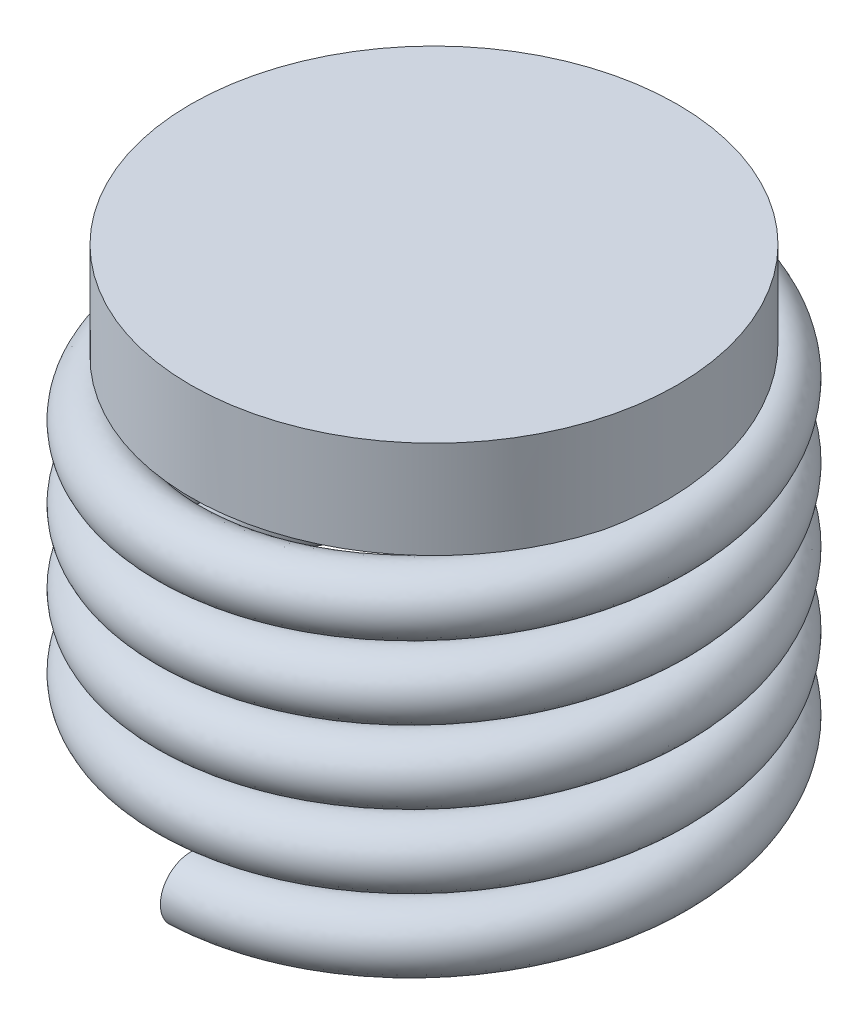
from build123d import *

# Parameters (mm, degrees)
SKETCH_1_R      = 10
EXTRUDE_1_DEPTH = 4
SWEEP_1_PITCH   = 3


with BuildPart() as part:
    # 草图1 → 凸台-拉伸1 (new body)
    with BuildSketch(Plane(origin=(0, 0, 0), x_dir=(1, 0, 0), z_dir=(0, 1, 0))):
        with Locations(Location((0, 0, 0), (0, 0, 270))):
            Circle(SKETCH_1_R)
    extrude(amount=EXTRUDE_1_DEPTH)

    # 扫描1: arcs per turn and ends read off the stored shape
    # 扫描1: the profile of 草图4 screwed along a right-hand helix through 4.625 turns, 10 arcs to a turn; built about Z, then put on its axis
    sweep_1_z = Axis((0, 0, 0), (0, 0, 1))
    sweep_1_corners = [(8.749229636, 0, -0.00589028), (9.999229636, 0, -1.25589028), (11.249229636, 0, -0.00589028), (9.999229636, 0, 1.24410972)]
    with BuildLine(mode=Mode.PRIVATE) as sweep_1_profile:
        ThreePointArc((8.749229636, 0, -0.00589028), (9.115346159, 0, -0.889773756), (9.999229636, 0, -1.25589028))
        ThreePointArc((9.999229636, 0, -1.25589028), (10.883113112, 0, -0.889773756), (11.249229636, 0, -0.00589028))
        ThreePointArc((11.249229636, 0, -0.00589028), (10.883113112, 0, 0.877993197), (9.999229636, 0, 1.24410972))
        ThreePointArc((9.999229636, 0, 1.24410972), (9.115346159, 0, 0.877993197), (8.749229636, 0, -0.00589028))
    sweep_1_cap = Face(sweep_1_profile.wire())
    sweep_1_arcs = [((8.749229636, 0, -0.00589028), (8.749229636, 0, -1.25589028), (9.999229636, 0, -1.25589028), (1, 0.7071067811865476, 1)), ((9.999229636, 0, -1.25589028), (11.249229636, 0, -1.25589028), (11.249229636, 0, -0.00589028), (1, 0.7071067811865476, 1)), ((11.249229636, 0, -0.00589028), (11.249229636, 0, 1.24410972), (9.999229636, 0, 1.24410972), (1, 0.7071067811865476, 1)), ((9.999229636, 0, 1.24410972), (8.749229636, 0, 1.24410972), (8.749229636, 0, -0.00589028), (1, 0.7071067811865476, 1))]  # start, shoulder, end, weights
    sweep_1_turn_angles = [0, 18, 36, 54, 72, 90, 108, 126, 144, 162, 180, 198, 216, 234, 252, 270, 288, 306, 324, 342, 360]
    sweep_1_turn_weights = [1, 0.9510565162951535, 1, 0.9510565162951535, 1, 0.9510565162951535, 1, 0.9510565162951535, 1, 0.9510565162951535, 1, 0.9510565162951535, 1, 0.9510565162951535, 1, 0.9510565162951535, 1, 0.9510565162951535, 1, 0.9510565162951535, 1]
    sweep_1_turn_sides = [Face.make_bezier_surface([[Vector(p[j][0], p[j][1], 0).rotate(sweep_1_z, sweep_1_turn_angles[2 * i + k]) / sweep_1_turn_weights[2 * i + k] + Vector(0, 0, p[j][2] + SWEEP_1_PITCH * sweep_1_turn_angles[2 * i + k] / 360) for k in range(3)] for j in range(3)], [[p[3][j] * sweep_1_turn_weights[2 * i + k] for k in range(3)] for j in range(3)]) for p in sweep_1_arcs for i in range(10)]
    sweep_1_last_angles = [1440, 1458, 1476, 1494, 1512, 1530, 1548, 1566, 1584, 1602, 1620, 1638, 1656, 1660.5, 1665]
    sweep_1_last_weights = [1, 0.9510565162951535, 1, 0.9510565162951535, 1, 0.9510565162951535, 1, 0.9510565162951535, 1, 0.9510565162951535, 1, 0.9510565162951535, 1, 0.996917333733128, 1]
    sweep_1_last_sides = [Face.make_bezier_surface([[Vector(p[j][0], p[j][1], 0).rotate(sweep_1_z, sweep_1_last_angles[2 * i + k]) / sweep_1_last_weights[2 * i + k] + Vector(0, 0, p[j][2] + SWEEP_1_PITCH * sweep_1_last_angles[2 * i + k] / 360) for k in range(3)] for j in range(3)], [[p[3][j] * sweep_1_last_weights[2 * i + k] for k in range(3)] for j in range(3)]) for p in sweep_1_arcs for i in range(7)]
    sweep_1 = Plane(origin=(0, 0, 0), x_dir=(-0.7071067811865537, 0, -0.7071067811865414), z_dir=(0, -1, 0)) * Solid(Shell([*[p.moved(Location((0, 0, SWEEP_1_PITCH * i))) for i in range(4) for p in sweep_1_turn_sides], *sweep_1_last_sides, sweep_1_cap, sweep_1_cap.rotate(sweep_1_z, 1665).moved(Location((0, 0, SWEEP_1_PITCH * 1665 / 360)))]))
    add(sweep_1)


solid = part.part
